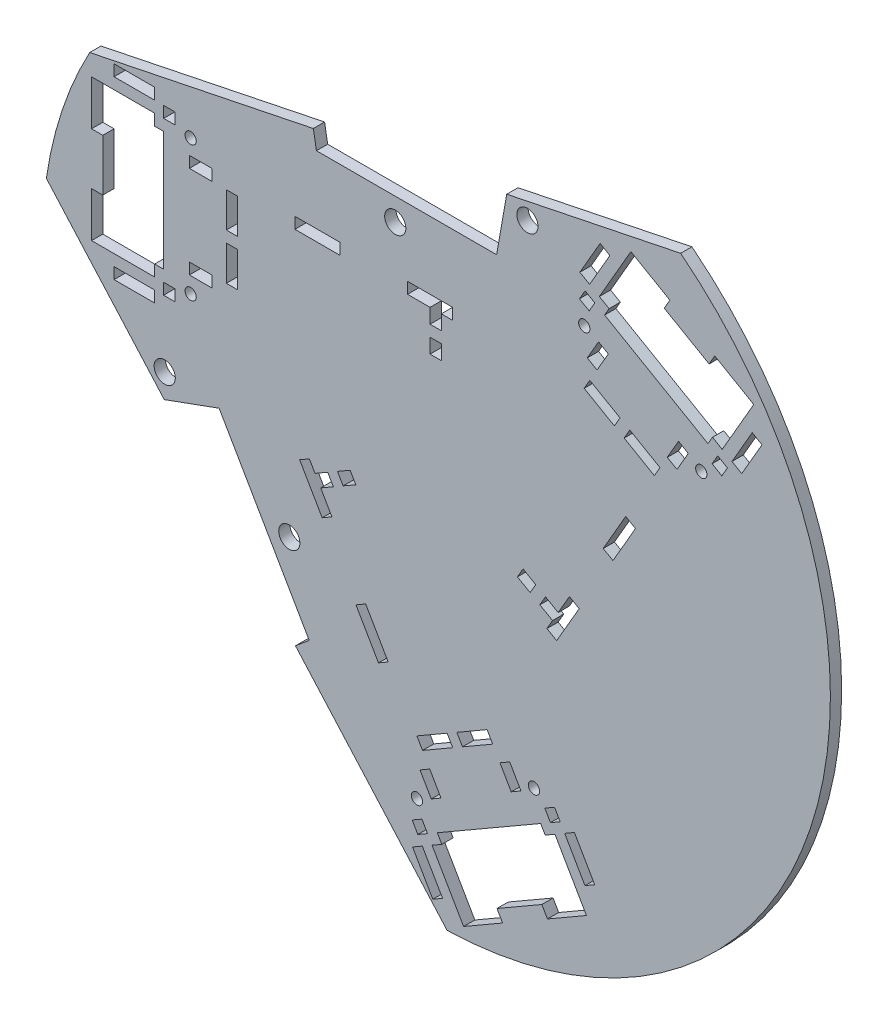
from build123d import *

# Parameters (mm, degrees)
ESQUISSE1_R             = 175
BOSS_EXTRU_1_DEPTH      = 5
ESQUISSE2_W             = 5
ESQUISSE2_H             = 6.5
ESQUISSE2_W_2           = 20
ESQUISSE2_H_2           = 5
ESQUISSE2_H_3           = 15.5
ESQUISSE2_W_3           = 10
ESQUISSE2_W_4           = 18
ESQUISSE2_H_4           = 20
ENL_V_MAT_EXTRU_1_DEPTH = 5
ENL_V_MAT_EXTRU_2_DEPTH = 5
ESQUISSE4_R             = 2.5
ENL_V_MAT_EXTRU_3_DEPTH = 5
ESQUISSE5_R             = 4.7
ENL_V_MAT_EXTRU_4_DEPTH = 5


with BuildPart() as part:
    # Esquisse1 → Boss.-Extru.1 (new body)
    with BuildSketch(Plane.XY):
        with Locations((148.080426897, -12.110171348)):
            Circle(ESQUISSE1_R)
    extrude(amount=BOSS_EXTRU_1_DEPTH)

    # Esquisse2 → Enlèv. mat.-Extru.1 (cut)
    with BuildSketch(Plane(origin=(0, 0, 0), x_dir=(-1, 0, 0), z_dir=(0, 0, -1))):
        Polygon((-155.311788567, 53.777441362), (-135.311788567, 53.777441362), (-135.311788567, 48.777441362), (-145.311788567, 48.777441362), (-145.311788567, 42.277441362), (-150.311788567, 42.277441362), (-150.311788567, 48.777441362), (-155.311788567, 48.777441362), align=None)
        with Locations((-147.811788567, 34.027441362)):
            Rectangle(ESQUISSE2_W, ESQUISSE2_H)
        with Locations((-95.311788567, 51.277441362)):
            Rectangle(ESQUISSE2_W_2, ESQUISSE2_H_2)
        with Locations((-57.36, 41.027441362)):
            Rectangle(ESQUISSE2_W, ESQUISSE2_H_3)
        with Locations((-57.36, 20.527441362)):
            Rectangle(ESQUISSE2_W, ESQUISSE2_H_3)
        with Locations((-43.43, 10.277441362)):
            Rectangle(ESQUISSE2_W_3, ESQUISSE2_H_2)
        with Locations((-29.5, -3.222558638)):
            Rectangle(ESQUISSE2_W, ESQUISSE2_H_2)
        with Locations((-14, -8.222558638)):
            Rectangle(ESQUISSE2_W_4, ESQUISSE2_H_2)
        with Locations((2.5, 9.277441362)):
            Rectangle(ESQUISSE2_W, ESQUISSE2_H_4)
        with Locations((2.5, 52.277441362)):
            Rectangle(ESQUISSE2_W, ESQUISSE2_H_4)
        with Locations((-14, 69.777441362)):
            Rectangle(ESQUISSE2_W_4, ESQUISSE2_H_2)
        with Locations((-29.5, 64.777441362)):
            Rectangle(ESQUISSE2_W, ESQUISSE2_H_2)
        with Locations((-43.43, 51.277441362)):
            Rectangle(ESQUISSE2_W_3, ESQUISSE2_H_2)
        Polygon((-87.404399659, -38.791434793), (-97.404399659, -56.111942869), (-101.734526678, -53.611942869), (-96.734526678, -44.951688831), (-102.363691803, -41.701688831), (-99.863691803, -37.371561812), (-94.234526678, -40.621561812), (-91.734526678, -36.291434793), align=None)
        Polygon((-104.193818822, -34.871561812), (-106.693818822, -39.201688831), (-112.322983946, -35.951688831), (-109.822983946, -31.621561812), align=None)
        Polygon((-112.404399659, -82.092704982), (-122.404399659, -99.413213058), (-126.734526678, -96.913213058), (-116.734526678, -79.592704982), align=None)
        Polygon((-139.460420962, -118.955108529), (-141.960420962, -123.285235548), (-155.38381472, -115.535235548), (-152.88381472, -111.205108529), align=None)
        Polygon((-157.213941739, -108.705108529), (-159.713941739, -113.035235548), (-173.137335498, -105.285235548), (-170.637335498, -100.955108529), align=None)
        Polygon((-176.352335498, -110.853778894), (-181.352335498, -119.514032932), (-185.682462517, -117.014032932), (-180.682462517, -108.353778894), align=None)
        Polygon((-196.258678449, -118.332576278), (-198.758678449, -122.662703297), (-203.088805468, -120.162703297), (-200.588805468, -115.832576278), align=None)
        Polygon((-205.088805468, -123.626804912), (-214.088805468, -139.215262181), (-218.418932487, -136.715262181), (-209.418932487, -121.126804912), align=None)
        Polygon((-212.258678449, -146.045389199), (-214.758678449, -150.375516218), (-197.438170373, -160.375516218), (-194.938170373, -156.045389199), align=None)
        Polygon((-175.019586086, -167.545389199), (-177.519586086, -171.875516218), (-160.199078011, -181.875516218), (-157.699078011, -177.545389199), align=None)
        Polygon((-141.868950992, -160.126804912), (-150.868950992, -175.715262181), (-146.538823973, -178.215262181), (-137.538823973, -162.626804912), align=None)
        Polygon((-139.868950992, -156.662703297), (-137.368950992, -152.332576278), (-141.699078011, -149.832576278), (-144.199078011, -154.162703297), align=None)
        Polygon((-145.845293943, -140.014032932), (-140.845293943, -131.353778894), (-145.175420962, -128.853778894), (-150.175420962, -137.514032932), align=None)
        Polygon((-201.525092463, -51.316520615), (-211.525092463, -33.996012539), (-207.194965444, -31.496012539), (-202.194965444, -40.156266577), (-196.56580032, -36.906266577), (-194.06580032, -41.236393596), (-199.694965444, -44.486393596), (-197.194965444, -48.816520615), align=None)
        Polygon((-189.735673301, -38.736393596), (-192.235673301, -34.406266577), (-186.606508176, -31.156266577), (-184.106508176, -35.486393596), align=None)
        Polygon((-226.525092463, -8.015250425), (-236.525092463, 9.30525765), (-232.194965444, 11.80525765), (-222.194965444, -5.515250425), align=None)
        Polygon((-244.920859728, 33.847153121), (-247.420859728, 38.17728014), (-233.997465969, 45.92728014), (-231.497465969, 41.597153121), align=None)
        Polygon((-227.16733895, 44.097153121), (-229.66733895, 48.42728014), (-216.243945192, 56.17728014), (-213.743945192, 51.847153121), align=None)
        Polygon((-219.458945192, 61.745823487), (-224.458945192, 70.406077524), (-220.128818173, 72.906077524), (-215.128818173, 64.245823487), align=None)
        Polygon((-215.982602241, 82.724620871), (-218.482602241, 87.05474789), (-214.152475222, 89.55474789), (-211.652475222, 85.224620871), align=None)
        Polygon((-216.152475222, 93.018849505), (-225.152475222, 108.607306773), (-220.822348203, 111.107306773), (-211.822348203, 95.518849505), align=None)
        Polygon((-231.982602241, 110.437433792), (-234.482602241, 114.767560811), (-251.803110316, 104.767560811), (-249.303110316, 100.437433792), align=None)
        Polygon((-269.221694603, 88.937433792), (-271.721694603, 93.267560811), (-289.042202679, 83.267560811), (-286.542202679, 78.937433792), align=None)
        Polygon((-279.372329698, 56.518849505), (-288.372329698, 72.107306773), (-292.702456717, 69.607306773), (-283.702456717, 54.018849505), align=None)
        Polygon((-277.372329698, 53.05474789), (-274.872329698, 48.724620871), (-270.542202679, 51.224620871), (-273.042202679, 55.55474789), align=None)
        Polygon((-259.965986747, 49.906077524), (-254.965986747, 41.245823487), (-250.635859728, 43.745823487), (-255.635859728, 52.406077524), align=None)
    extrude(amount=-ENL_V_MAT_EXTRU_1_DEPTH, mode=Mode.SUBTRACT)

    # Esquisse3 → Enlèv. mat.-Extru.2 (cut)
    with BuildSketch(Plane(origin=(0, 0, 0), x_dir=(-1, 0, 0), z_dir=(0, 0, -1))):
        Polygon((0, -0.722558638), (-23, -0.722558638), (-23, 4.277441362), (-27, 4.277441362), (-27, 57.277441362), (-23, 57.277441362), (-23, 62.277441362), (0, 62.277441362), align=None)
        Polygon((-212.258678449, -146.045389199), (-200.758678449, -126.126804912), (-196.42855143, -128.626804912), (-194.42855143, -125.162703297), (-148.52920503, -151.662703297), (-150.52920503, -155.126804912), (-146.199078011, -157.626804912), (-157.699078011, -177.545389199), align=None)
        Polygon((-231.982602241, 110.437433792), (-220.482602241, 90.518849505), (-224.81272926, 88.018849505), (-222.81272926, 84.55474789), (-268.71207566, 58.05474789), (-270.71207566, 61.518849505), (-275.042202679, 59.018849505), (-286.542202679, 78.937433792), align=None)
    extrude(amount=-ENL_V_MAT_EXTRU_2_DEPTH, mode=Mode.SUBTRACT)

    # Esquisse4 → Enlèv. mat.-Extru.3 (cut)
    with BuildSketch(Plane(origin=(0, 0, 0), x_dir=(-1, 0, 0), z_dir=(0, 0, -1))):
        with Locations((-39, 60.777441362)):
            Circle(ESQUISSE4_R)
        with Locations((-39, 0.777441362)):
            Circle(ESQUISSE4_R)
        with Locations((-139.498116116, -143.020398452)):
            Circle(ESQUISSE4_R)
        with Locations((-191.459640343, -113.020398452)):
            Circle(ESQUISSE4_R)
        with Locations((-265.743164573, 45.912443044)):
            Circle(ESQUISSE4_R)
        with Locations((-213.781640346, 75.912443044)):
            Circle(ESQUISSE4_R)
    extrude(amount=-ENL_V_MAT_EXTRU_3_DEPTH, mode=Mode.SUBTRACT)

    # Esquisse5 → Enlèv. mat.-Extru.4 (cut)
    with BuildSketch(Plane(origin=(0, 0, 0), x_dir=(-1, 0, 0), z_dir=(0, 0, -1))):
        with Locations((-188.54080573, 103.777441362)):
            Circle(ESQUISSE5_R)
        with Locations((-129.859999997, 73.777441362)):
            Circle(ESQUISSE5_R)
        with Locations((-27.488620889, -35.014261787)):
            Circle(ESQUISSE5_R)
        with Locations((-82.809785869, -70.833330267)):
            Circle(ESQUISSE5_R)
        Polygon((9.513160253, 70.443581698), (-93.474910733, 91.632672923), (-94.859999997, 83.777441362), (-174.859999997, 83.777441362), (-179.360865983, 109.303120805), (-315.699358344, 137.35383313), (-290.787179805, 258.437705227), (34.425338792, 191.527453795), align=None)
        Polygon((-155.383573155, -189.867097817), (-85.539246378, -111.271357669), (-91.649531831, -106.144219399), (-51.649531831, -36.862187096), (-27.293211991, -45.727162534), (65.168663657, 58.320079201), (157.574283612, -23.796436326), (-62.9779532, -271.983613344), align=None)
    extrude(amount=-ENL_V_MAT_EXTRU_4_DEPTH, mode=Mode.SUBTRACT)


solid = part.part
